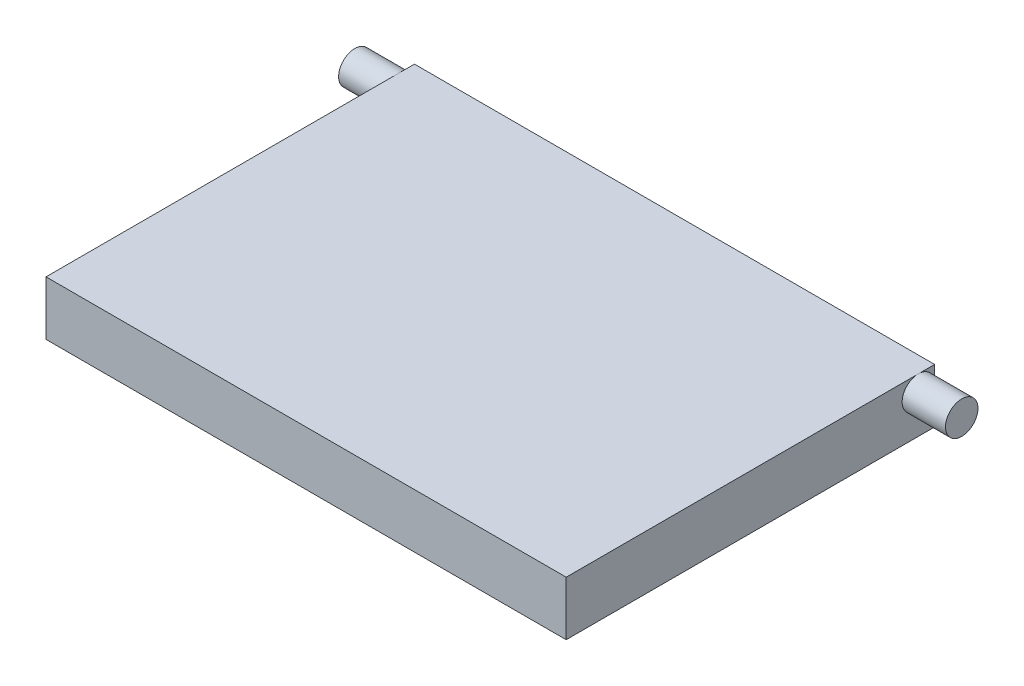
from build123d import *

# Parameters (mm, degrees)
SKETCH1_W           = 24
SKETCH1_H           = 17
BOSS_EXTRUDE1_DEPTH = 2.5
SKETCH2_R           = 0.75
BOSS_EXTRUDE2_DEPTH = 14


with BuildPart() as part:
    # Sketch1 → Boss-Extrude1 (new body)
    with BuildSketch(Plane(origin=(0, 0, 0), x_dir=(1, 0, 0), z_dir=(0, 1, 0))):
        Rectangle(SKETCH1_W, SKETCH1_H)
    extrude(amount=BOSS_EXTRUDE1_DEPTH)

    # Sketch2 → Boss-Extrude2 (add, symmetric)
    with BuildSketch(Plane(origin=(0, 0, 0), x_dir=(0, 0, -1), z_dir=(1, 0, 0))):
        with Locations((7.75, 1.75)):
            Circle(SKETCH2_R)
    extrude(amount=BOSS_EXTRUDE2_DEPTH, both=True)


solid = part.part
